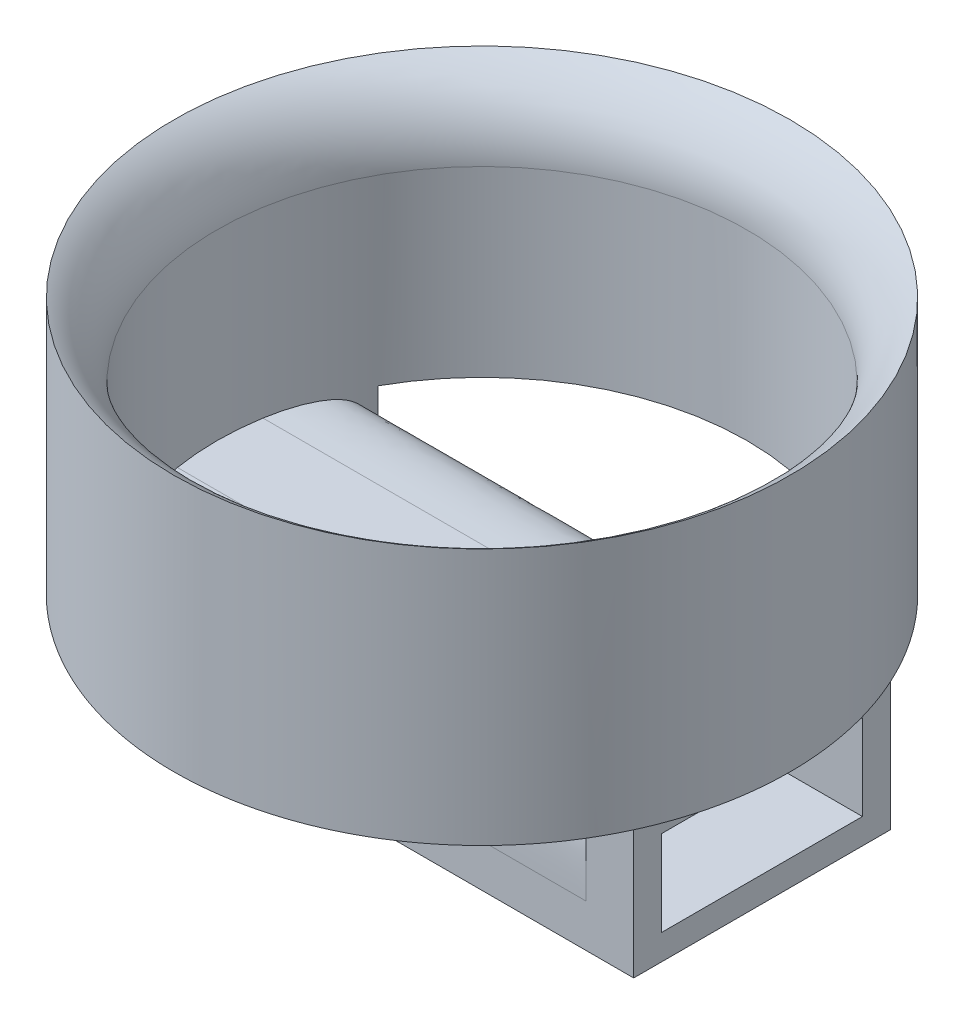
from build123d import *

# Parameters (mm, degrees)
SKETCH_1_R          = 36
EXTRUDE_1_DEPTH     = 30
SKETCH_2_R          = 31
CUT_EXTRUDE_1_DEPTH = 30
FILLET_1_R          = 10
SKETCH_11_W         = 65.45159038682868
SKETCH_11_H         = 30
EXTRUDE_8_DEPTH     = 15
CUT_EXTRUDE_3_DEPTH = 84.18193869444944
CUT_EXTRUDE_4_DEPTH = 58.00000000000003
FILLET_2_SIZE       = 10


with BuildPart() as part:
    # 草圖1 → 填料-伸長1 (new body)
    with BuildSketch(Plane(origin=(0, 0, 0), x_dir=(1, 0, 0), z_dir=(0, 1, 0))):
        with Locations(Location((0, 0, 0), (0, 0, 270))):
            Circle(SKETCH_1_R)
    extrude(amount=EXTRUDE_1_DEPTH)

    # 草圖2 → 除料-伸長1 (cut)
    with BuildSketch(Plane(origin=(0, 30, 0), x_dir=(1, 0, 0), z_dir=(0, 1, 0))):
        with Locations(Location((0, 0, 0), (0, 0, 270))):
            Circle(SKETCH_2_R)
    extrude(amount=-CUT_EXTRUDE_1_DEPTH, mode=Mode.SUBTRACT)

    # 圓角1
    # the kernel refuses this fillet: 10 mm, written as the material it takes off along each edge
    with BuildSketch(Plane(origin=(0, 30, 0), x_dir=(-1.8e-16, 0, 1), z_dir=(-1, 0, -1.8e-16))) as fillet_1_piece_1:
        with BuildLine():
            CenterArc((41, -8.660254037844858), FILLET_1_R, 119.99999999999864, 60.000000000001364)
            Line((31.000000000000004, -8.660254037844858), (30.800000000000004, -8.660254037844858))
            Line((30.800000000000004, -8.660254037844858), (30.8, 0))
            Line((30.8, 0), (31, 0.1999999999999993))
            ThreePointArc((31, 0.1999999999999993), (33.5000000000001, 0.1999999999999993), (35.90000000000021, 0.17320508075653507))
            Line((35.90000000000021, 0.17320508075653507), (36.000000000000206, -3.5527e-13))
        make_face()
    revolve(axis=Axis((0, 30, 0), (0, 1, 0)), mode=Mode.SUBTRACT)

    # 草圖11 → 填料-伸長8 (add)
    with BuildSketch(Plane(origin=(0, 0, 0), x_dir=(1, 0, 0), z_dir=(0, 1, 0))):
        Rectangle(SKETCH_11_W, SKETCH_11_H)
    extrude(amount=-EXTRUDE_8_DEPTH)

    # 草圖16 → 除料-伸長3 (cut, through all)
    with BuildSketch(Plane.ZY.offset(32.72579519341434)):
        Polygon((-11.724999999999989, -2.02034535171655), (11.725000000000014, -2.02034535171655), (11.725000000000014, -12.02034535171655), (-11.724999999999985, -12.02034535171655), align=None)
    extrude(amount=-CUT_EXTRUDE_3_DEPTH, mode=Mode.SUBTRACT)

    # 草圖19 → 除料-伸長4 (cut)
    with BuildSketch(Plane.ZY.offset(32.72579519341434)):
        Polygon((-11.72500000000632, -6.624703450403075), (-12.725000000017417, -6.624703450403075), (-12.725000000017417, -5.624703450403075), (-13.725000000017417, -5.624703450403075), (-13.725000000017417, -8.624839762103937), (-12.725000000017417, -8.624839762103937), (-12.725000000017417, -7.624703450403074), (-11.72500000000632, -7.624703450403074), align=None)
    extrude(amount=-CUT_EXTRUDE_4_DEPTH, mode=Mode.SUBTRACT)

    # 圓角2
    # a fillet whose section is not a circle: 10 mm, written as the material it takes off along each edge
    with BuildSketch(Plane(origin=(52.129319932501346, 0, 15.000000000000002), x_dir=(0, -1, 0), z_dir=(-1, 0, 0))) as fillet_2_piece_1_section:
        with BuildLine():
            Bezier((FILLET_2_SIZE, 0), (0, 0), (0, -FILLET_2_SIZE), weights=[1, 2.3333333333333304, 1])
            Line((0, -FILLET_2_SIZE), (-FILLET_2_SIZE * 0.02, -FILLET_2_SIZE))
            Line((-FILLET_2_SIZE * 0.02, -FILLET_2_SIZE), (-FILLET_2_SIZE * 0.02, FILLET_2_SIZE * 0.02))
            Line((-FILLET_2_SIZE * 0.02, FILLET_2_SIZE * 0.02), (FILLET_2_SIZE, FILLET_2_SIZE * 0.02))
            Line((FILLET_2_SIZE, FILLET_2_SIZE * 0.02), (FILLET_2_SIZE, 0))
        make_face()
    fillet_2_piece_1 = extrude(amount=104.25863986500269, mode=Mode.PRIVATE)
    fillet_2_piece_1 = split(fillet_2_piece_1, bisect_by=Plane(origin=(52.129319932501346, 0, 15.000000000000002), z_dir=(0, -1, 0)), keep=Keep.TOP, mode=Mode.PRIVATE)
    fillet_2_piece_1 = fillet_2_piece_1 & Plane(origin=(0, 0, 0), x_dir=(-1.8e-16, 0, 1), z_dir=(0, 1, 0)) * Cylinder(31, 249, mode=Mode.PRIVATE)
    add(fillet_2_piece_1, mode=Mode.SUBTRACT)
    with BuildSketch(Plane(origin=(-52.12931993250088, 0, -14.999999999999998), x_dir=(0, -1, 0), z_dir=(1, 0, 0))) as fillet_2_piece_2_section:
        with BuildLine():
            Bezier((FILLET_2_SIZE, 0), (0, 0), (0, -FILLET_2_SIZE), weights=[1, 2.3333333333333304, 1])
            Line((0, -FILLET_2_SIZE), (-FILLET_2_SIZE * 0.02, -FILLET_2_SIZE))
            Line((-FILLET_2_SIZE * 0.02, -FILLET_2_SIZE), (-FILLET_2_SIZE * 0.02, FILLET_2_SIZE * 0.02))
            Line((-FILLET_2_SIZE * 0.02, FILLET_2_SIZE * 0.02), (FILLET_2_SIZE, FILLET_2_SIZE * 0.02))
            Line((FILLET_2_SIZE, FILLET_2_SIZE * 0.02), (FILLET_2_SIZE, 0))
        make_face()
    fillet_2_piece_2 = extrude(amount=104.25863986500174, mode=Mode.PRIVATE)
    fillet_2_piece_2 = split(fillet_2_piece_2, bisect_by=Plane(origin=(-52.12931993250088, 0, -14.999999999999998), z_dir=(0, -1, 0)), keep=Keep.TOP, mode=Mode.PRIVATE)
    fillet_2_piece_2 = fillet_2_piece_2 & Plane(origin=(0, 0, 0), x_dir=(-1.8e-16, 0, 1), z_dir=(0, 1, 0)) * Cylinder(31, 249, mode=Mode.PRIVATE)
    add(fillet_2_piece_2, mode=Mode.SUBTRACT)


solid = part.part
